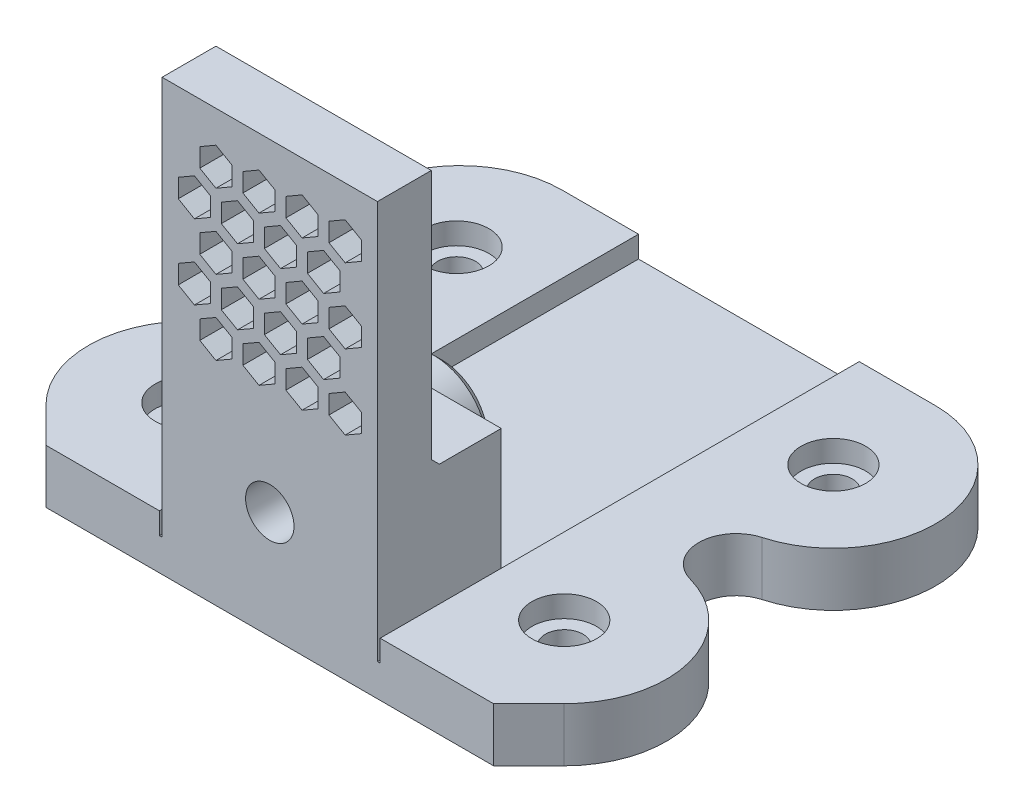
from build123d import *

# Parameters (mm, degrees)
BOSS_EXTRUDE1_DEPTH    = 20
SKETCH2_R              = 5
SKETCH2_R_2            = 2.25
BOSS_EXTRUDE2_DEPTH    = 4.5
CHAMFER1_SIZE          = 0.75
CUT_EXTRUDE1_START     = -11.5
CUT_EXTRUDE1_OUTLINE_R = 2.25
CUT_EXTRUDE1_DEPTH     = 11.5
SKETCH3_R              = 1.75
BOSS_EXTRUDE3_DEPTH    = 3
BOSS_EXTRUDE4_START    = 2
SKETCH4_R              = 3
BOSS_EXTRUDE4_DEPTH    = 2
CUT_EXTRUDE2_REACH     = 69.217


# Read off the part's stored shape, not the designer's step: Cut-Extrude1
with BuildPart() as part:
    # Sketch1 → Boss-Extrude1 (new body)
    with BuildSketch(Plane(origin=(0, 0, 0), x_dir=(0, 0, -1), z_dir=(1, 0, 0))):
        Polygon((0, 0), (0, 40), (5, 40), (5, 16.75), (5.75, 16), (11.5, 16), (11.5, 3), (44.5, 3), (44.5, 0), align=None)
    extrude(amount=-BOSS_EXTRUDE1_DEPTH)

    # Sketch2 → Boss-Extrude2 (add)
    with BuildSketch(Plane(origin=(0, 0, -11.5), x_dir=(-1, 0, 0), z_dir=(0, 0, -1))):
        with Locations(Location((10, 10, 0), (0, 0, 90))):
            Circle(SKETCH2_R)
        with Locations(Location((10, 10, 0), (0, 0, 90))):
            Circle(SKETCH2_R_2, mode=Mode.SUBTRACT)
    extrude(amount=BOSS_EXTRUDE2_DEPTH)

    # Chamfer1
    chamfer1_edges = [part.edges().sort_by_distance(p)[0] for p in [
        (-10, 5, -16),
    ]]
    chamfer(chamfer1_edges, length=CHAMFER1_SIZE)

    # Cut-Extrude1 outline → Cut-Extrude1 (cut)
    with BuildSketch(Plane(origin=(0, 0, -11.5), x_dir=(-1, 0, 0), z_dir=(0, 0, -1)).offset(CUT_EXTRUDE1_START)):
        with Locations((10, 10)):
            Circle(CUT_EXTRUDE1_OUTLINE_R)
    extrude(amount=CUT_EXTRUDE1_DEPTH, mode=Mode.SUBTRACT)

    # Sketch3 → Boss-Extrude3 (add)
    with BuildSketch(Plane(origin=(0, 3, 0), x_dir=(1, 0, 0), z_dir=(0, 1, 0))):
        with BuildLine():
            Line((0, 44.5), (7.35, 44.5))
            ThreePointArc((7.35, 44.5), (16.762886596, 36.283575445), (9.893610548, 25.846855984))
            ThreePointArc((9.893610548, 25.846855984), (7.35, 22.5), (9.893610548, 19.153144016))
            ThreePointArc((9.893610548, 19.153144016), (16.537576325, 12.416286669), (14.067514421, 3.282485579))
            Line((14.067514421, 3.282485579), (10.785028843, 0))
            Line((10.785028843, 0), (0, 0))
            Line((0, 0), (0, 11.5))
            Line((0, 11.5), (-20, 11.5))
            Line((-20, 11.5), (-20, 0))
            Line((-20, 0), (-30.785028843, 0))
            Line((-30.785028843, 0), (-34.067514421, 3.282485579))
            ThreePointArc((-34.067514421, 3.282485579), (-36.537576325, 12.416286669), (-29.893610548, 19.153144016))
            ThreePointArc((-29.893610548, 19.153144016), (-27.35, 22.5), (-29.893610548, 25.846855984))
            ThreePointArc((-29.893610548, 25.846855984), (-36.762886596, 36.283575445), (-27.35, 44.5))
            Line((-27.35, 44.5), (-20, 44.5))
            Line((-20, 44.5), (0, 44.5))
        make_face()
        with Locations(Location((7.35, 10, 0), (0, 0, 270))):
            Circle(SKETCH3_R, mode=Mode.SUBTRACT)
        with Locations(Location((7.35, 35, 0), (0, 0, 270))):
            Circle(SKETCH3_R, mode=Mode.SUBTRACT)
        with Locations(Location((-27.65, 10, 0), (0, 0, 270))):
            Circle(SKETCH3_R, mode=Mode.SUBTRACT)
        with Locations(Location((-27.65, 35, 0), (0, 0, 270))):
            Circle(SKETCH3_R, mode=Mode.SUBTRACT)
    extrude(amount=-BOSS_EXTRUDE3_DEPTH)

    # Sketch4 → Boss-Extrude4 (add)
    # profile 1 of 2: a face of its own
    with BuildSketch(Plane(origin=(0, 3, 0), x_dir=(1, 0, 0), z_dir=(0, 1, 0)).offset(BOSS_EXTRUDE4_START)):
        with BuildLine():
            Line((-30.785028843, 0), (-20.25, 0))
            Line((-20.25, 0), (-20.25, 44.5))
            Line((-20.25, 44.5), (-27.35, 44.5))
            ThreePointArc((-27.35, 44.5), (-36.762886596, 36.283575445), (-29.893610548, 25.846855984))
            ThreePointArc((-29.893610548, 25.846855984), (-27.35, 22.5), (-29.893610548, 19.153144016))
            ThreePointArc((-29.893610548, 19.153144016), (-36.537576325, 12.416286669), (-34.067514421, 3.282485579))
            Line((-34.067514421, 3.282485579), (-30.785028843, 0))
        make_face()
        with Locations(Location((-27.65, 10, 0), (0, 0, 270))):
            Circle(SKETCH4_R, mode=Mode.SUBTRACT)
        with Locations(Location((-27.65, 35, 0), (0, 0, 270))):
            Circle(SKETCH4_R, mode=Mode.SUBTRACT)
    # profile 2 of 2: a face of its own
    with BuildSketch(Plane(origin=(0, 3, 0), x_dir=(1, 0, 0), z_dir=(0, 1, 0)).offset(BOSS_EXTRUDE4_START)):
        with BuildLine():
            Line((10.785028843, 0), (14.067514421, 3.282485579))
            ThreePointArc((14.067514421, 3.282485579), (16.537576325, 12.416286669), (9.893610548, 19.153144016))
            ThreePointArc((9.893610548, 19.153144016), (7.35, 22.5), (9.893610548, 25.846855984))
            ThreePointArc((9.893610548, 25.846855984), (16.762886596, 36.283575445), (7.35, 44.5))
            Line((7.35, 44.5), (0.25, 44.5))
            Line((0.25, 44.5), (0.25, 0))
            Line((0.25, 0), (10.785028843, 0))
        make_face()
        with Locations(Location((7.35, 35, 0), (0, 0, 270))):
            Circle(SKETCH4_R, mode=Mode.SUBTRACT)
        with Locations(Location((7.35, 10, 0), (0, 0, 270))):
            Circle(SKETCH4_R, mode=Mode.SUBTRACT)
    extrude(amount=-BOSS_EXTRUDE4_DEPTH)

    # Sketch5 → Cut-Extrude2 (cut, up to next)
    with BuildSketch(Plane(origin=(0, 0, -5), x_dir=(-1, 0, 0), z_dir=(0, 0, -1)), mode=Mode.PRIVATE) as cut_extrude2_sk1:
        Polygon((3, 19.714745962), (4.5, 20.580771366), (4.5, 22.312822174), (3, 23.178847577), (1.5, 22.312822174), (1.5, 20.580771366), align=None)
    cut_extrude2_tool1 = extrude(cut_extrude2_sk1.sketch, amount=-CUT_EXTRUDE2_REACH, mode=Mode.PRIVATE) & part.part
    # Sketch5 → Cut-Extrude2 (cut, up to next)
    with BuildSketch(Plane(origin=(0, 0, -5), x_dir=(-1, 0, 0), z_dir=(0, 0, -1)), mode=Mode.PRIVATE) as cut_extrude2_sk2:
        Polygon((7, 19.714745962), (8.5, 20.580771366), (8.5, 22.312822174), (7, 23.178847577), (5.5, 22.312822174), (5.5, 20.580771366), align=None)
    cut_extrude2_tool2 = extrude(cut_extrude2_sk2.sketch, amount=-CUT_EXTRUDE2_REACH, mode=Mode.PRIVATE) & part.part
    # Sketch5 → Cut-Extrude2 (cut, up to next)
    with BuildSketch(Plane(origin=(0, 0, -5), x_dir=(-1, 0, 0), z_dir=(0, 0, -1)), mode=Mode.PRIVATE) as cut_extrude2_sk3:
        Polygon((11, 19.714745962), (12.5, 20.580771366), (12.5, 22.312822174), (11, 23.178847577), (9.5, 22.312822174), (9.5, 20.580771366), align=None)
    cut_extrude2_tool3 = extrude(cut_extrude2_sk3.sketch, amount=-CUT_EXTRUDE2_REACH, mode=Mode.PRIVATE) & part.part
    # Sketch5 → Cut-Extrude2 (cut, up to next)
    with BuildSketch(Plane(origin=(0, 0, -5), x_dir=(-1, 0, 0), z_dir=(0, 0, -1)), mode=Mode.PRIVATE) as cut_extrude2_sk4:
        Polygon((15, 19.714745962), (16.5, 20.580771366), (16.5, 22.312822174), (15, 23.178847577), (13.5, 22.312822174), (13.5, 20.580771366), align=None)
    cut_extrude2_tool4 = extrude(cut_extrude2_sk4.sketch, amount=-CUT_EXTRUDE2_REACH, mode=Mode.PRIVATE) & part.part
    # Sketch5 → Cut-Extrude2 (cut, up to next)
    with BuildSketch(Plane(origin=(0, 0, -5), x_dir=(-1, 0, 0), z_dir=(0, 0, -1)), mode=Mode.PRIVATE) as cut_extrude2_sk5:
        Polygon((5, 23.178847577), (6.5, 24.044872981), (6.5, 25.776923789), (5, 26.642949192), (3.5, 25.776923789), (3.5, 24.044872981), align=None)
    cut_extrude2_tool5 = extrude(cut_extrude2_sk5.sketch, amount=-CUT_EXTRUDE2_REACH, mode=Mode.PRIVATE) & part.part
    # Sketch5 → Cut-Extrude2 (cut, up to next)
    with BuildSketch(Plane(origin=(0, 0, -5), x_dir=(-1, 0, 0), z_dir=(0, 0, -1)), mode=Mode.PRIVATE) as cut_extrude2_sk6:
        Polygon((9, 23.178847577), (10.5, 24.044872981), (10.5, 25.776923789), (9, 26.642949192), (7.5, 25.776923789), (7.5, 24.044872981), align=None)
    cut_extrude2_tool6 = extrude(cut_extrude2_sk6.sketch, amount=-CUT_EXTRUDE2_REACH, mode=Mode.PRIVATE) & part.part
    # Sketch5 → Cut-Extrude2 (cut, up to next)
    with BuildSketch(Plane(origin=(0, 0, -5), x_dir=(-1, 0, 0), z_dir=(0, 0, -1)), mode=Mode.PRIVATE) as cut_extrude2_sk7:
        Polygon((13, 23.178847577), (14.5, 24.044872981), (14.5, 25.776923789), (13, 26.642949192), (11.5, 25.776923789), (11.5, 24.044872981), align=None)
    cut_extrude2_tool7 = extrude(cut_extrude2_sk7.sketch, amount=-CUT_EXTRUDE2_REACH, mode=Mode.PRIVATE) & part.part
    # Sketch5 → Cut-Extrude2 (cut, up to next)
    with BuildSketch(Plane(origin=(0, 0, -5), x_dir=(-1, 0, 0), z_dir=(0, 0, -1)), mode=Mode.PRIVATE) as cut_extrude2_sk8:
        Polygon((17, 23.178847577), (18.5, 24.044872981), (18.5, 25.776923789), (17, 26.642949192), (15.5, 25.776923789), (15.5, 24.044872981), align=None)
    cut_extrude2_tool8 = extrude(cut_extrude2_sk8.sketch, amount=-CUT_EXTRUDE2_REACH, mode=Mode.PRIVATE) & part.part
    # Sketch5 → Cut-Extrude2 (cut, up to next)
    with BuildSketch(Plane(origin=(0, 0, -5), x_dir=(-1, 0, 0), z_dir=(0, 0, -1)), mode=Mode.PRIVATE) as cut_extrude2_sk9:
        Polygon((3, 26.642949192), (4.5, 27.508974596), (4.5, 29.241025404), (3, 30.107050808), (1.5, 29.241025404), (1.5, 27.508974596), align=None)
    cut_extrude2_tool9 = extrude(cut_extrude2_sk9.sketch, amount=-CUT_EXTRUDE2_REACH, mode=Mode.PRIVATE) & part.part
    # Sketch5 → Cut-Extrude2 (cut, up to next)
    with BuildSketch(Plane(origin=(0, 0, -5), x_dir=(-1, 0, 0), z_dir=(0, 0, -1)), mode=Mode.PRIVATE) as cut_extrude2_sk10:
        Polygon((7, 26.642949192), (8.5, 27.508974596), (8.5, 29.241025404), (7, 30.107050808), (5.5, 29.241025404), (5.5, 27.508974596), align=None)
    cut_extrude2_tool10 = extrude(cut_extrude2_sk10.sketch, amount=-CUT_EXTRUDE2_REACH, mode=Mode.PRIVATE) & part.part
    # Sketch5 → Cut-Extrude2 (cut, up to next)
    with BuildSketch(Plane(origin=(0, 0, -5), x_dir=(-1, 0, 0), z_dir=(0, 0, -1)), mode=Mode.PRIVATE) as cut_extrude2_sk11:
        Polygon((11, 26.642949192), (12.5, 27.508974596), (12.5, 29.241025404), (11, 30.107050808), (9.5, 29.241025404), (9.5, 27.508974596), align=None)
    cut_extrude2_tool11 = extrude(cut_extrude2_sk11.sketch, amount=-CUT_EXTRUDE2_REACH, mode=Mode.PRIVATE) & part.part
    # Sketch5 → Cut-Extrude2 (cut, up to next)
    with BuildSketch(Plane(origin=(0, 0, -5), x_dir=(-1, 0, 0), z_dir=(0, 0, -1)), mode=Mode.PRIVATE) as cut_extrude2_sk12:
        Polygon((15, 26.642949192), (16.5, 27.508974596), (16.5, 29.241025404), (15, 30.107050808), (13.5, 29.241025404), (13.5, 27.508974596), align=None)
    cut_extrude2_tool12 = extrude(cut_extrude2_sk12.sketch, amount=-CUT_EXTRUDE2_REACH, mode=Mode.PRIVATE) & part.part
    # Sketch5 → Cut-Extrude2 (cut, up to next)
    with BuildSketch(Plane(origin=(0, 0, -5), x_dir=(-1, 0, 0), z_dir=(0, 0, -1)), mode=Mode.PRIVATE) as cut_extrude2_sk13:
        Polygon((5, 30.107050808), (6.5, 30.973076211), (6.5, 32.705127019), (5, 33.571152423), (3.5, 32.705127019), (3.5, 30.973076211), align=None)
    cut_extrude2_tool13 = extrude(cut_extrude2_sk13.sketch, amount=-CUT_EXTRUDE2_REACH, mode=Mode.PRIVATE) & part.part
    # Sketch5 → Cut-Extrude2 (cut, up to next)
    with BuildSketch(Plane(origin=(0, 0, -5), x_dir=(-1, 0, 0), z_dir=(0, 0, -1)), mode=Mode.PRIVATE) as cut_extrude2_sk14:
        Polygon((9, 30.107050808), (10.5, 30.973076211), (10.5, 32.705127019), (9, 33.571152423), (7.5, 32.705127019), (7.5, 30.973076211), align=None)
    cut_extrude2_tool14 = extrude(cut_extrude2_sk14.sketch, amount=-CUT_EXTRUDE2_REACH, mode=Mode.PRIVATE) & part.part
    # Sketch5 → Cut-Extrude2 (cut, up to next)
    with BuildSketch(Plane(origin=(0, 0, -5), x_dir=(-1, 0, 0), z_dir=(0, 0, -1)), mode=Mode.PRIVATE) as cut_extrude2_sk15:
        Polygon((13, 30.107050808), (14.5, 30.973076211), (14.5, 32.705127019), (13, 33.571152423), (11.5, 32.705127019), (11.5, 30.973076211), align=None)
    cut_extrude2_tool15 = extrude(cut_extrude2_sk15.sketch, amount=-CUT_EXTRUDE2_REACH, mode=Mode.PRIVATE) & part.part
    # Sketch5 → Cut-Extrude2 (cut, up to next)
    with BuildSketch(Plane(origin=(0, 0, -5), x_dir=(-1, 0, 0), z_dir=(0, 0, -1)), mode=Mode.PRIVATE) as cut_extrude2_sk16:
        Polygon((17, 30.107050808), (18.5, 30.973076211), (18.5, 32.705127019), (17, 33.571152423), (15.5, 32.705127019), (15.5, 30.973076211), align=None)
    cut_extrude2_tool16 = extrude(cut_extrude2_sk16.sketch, amount=-CUT_EXTRUDE2_REACH, mode=Mode.PRIVATE) & part.part
    # Sketch5 → Cut-Extrude2 (cut, up to next)
    with BuildSketch(Plane(origin=(0, 0, -5), x_dir=(-1, 0, 0), z_dir=(0, 0, -1)), mode=Mode.PRIVATE) as cut_extrude2_sk17:
        Polygon((3, 33.571152423), (4.5, 34.437177826), (4.5, 36.169228634), (3, 37.035254038), (1.5, 36.169228634), (1.5, 34.437177826), align=None)
    cut_extrude2_tool17 = extrude(cut_extrude2_sk17.sketch, amount=-CUT_EXTRUDE2_REACH, mode=Mode.PRIVATE) & part.part
    # Sketch5 → Cut-Extrude2 (cut, up to next)
    with BuildSketch(Plane(origin=(0, 0, -5), x_dir=(-1, 0, 0), z_dir=(0, 0, -1)), mode=Mode.PRIVATE) as cut_extrude2_sk18:
        Polygon((7, 33.571152423), (8.5, 34.437177826), (8.5, 36.169228634), (7, 37.035254038), (5.5, 36.169228634), (5.5, 34.437177826), align=None)
    cut_extrude2_tool18 = extrude(cut_extrude2_sk18.sketch, amount=-CUT_EXTRUDE2_REACH, mode=Mode.PRIVATE) & part.part
    # Sketch5 → Cut-Extrude2 (cut, up to next)
    with BuildSketch(Plane(origin=(0, 0, -5), x_dir=(-1, 0, 0), z_dir=(0, 0, -1)), mode=Mode.PRIVATE) as cut_extrude2_sk19:
        Polygon((11, 33.571152423), (12.5, 34.437177826), (12.5, 36.169228634), (11, 37.035254038), (9.5, 36.169228634), (9.5, 34.437177826), align=None)
    cut_extrude2_tool19 = extrude(cut_extrude2_sk19.sketch, amount=-CUT_EXTRUDE2_REACH, mode=Mode.PRIVATE) & part.part
    # Sketch5 → Cut-Extrude2 (cut, up to next)
    with BuildSketch(Plane(origin=(0, 0, -5), x_dir=(-1, 0, 0), z_dir=(0, 0, -1)), mode=Mode.PRIVATE) as cut_extrude2_sk20:
        Polygon((15, 33.571152423), (16.5, 34.437177826), (16.5, 36.169228634), (15, 37.035254038), (13.5, 36.169228634), (13.5, 34.437177826), align=None)
    cut_extrude2_tool20 = extrude(cut_extrude2_sk20.sketch, amount=-CUT_EXTRUDE2_REACH, mode=Mode.PRIVATE) & part.part
    add(cut_extrude2_tool1.solids().sort_by_distance((-3, 21.446797, -5))[0], mode=Mode.SUBTRACT)
    add(cut_extrude2_tool2.solids().sort_by_distance((-7, 21.446797, -5))[0], mode=Mode.SUBTRACT)
    add(cut_extrude2_tool3.solids().sort_by_distance((-11, 21.446797, -5))[0], mode=Mode.SUBTRACT)
    add(cut_extrude2_tool4.solids().sort_by_distance((-15, 21.446797, -5))[0], mode=Mode.SUBTRACT)
    add(cut_extrude2_tool5.solids().sort_by_distance((-5, 24.910898, -5))[0], mode=Mode.SUBTRACT)
    add(cut_extrude2_tool6.solids().sort_by_distance((-9, 24.910898, -5))[0], mode=Mode.SUBTRACT)
    add(cut_extrude2_tool7.solids().sort_by_distance((-13, 24.910898, -5))[0], mode=Mode.SUBTRACT)
    add(cut_extrude2_tool8.solids().sort_by_distance((-17, 24.910898, -5))[0], mode=Mode.SUBTRACT)
    add(cut_extrude2_tool9.solids().sort_by_distance((-3, 28.375, -5))[0], mode=Mode.SUBTRACT)
    add(cut_extrude2_tool10.solids().sort_by_distance((-7, 28.375, -5))[0], mode=Mode.SUBTRACT)
    add(cut_extrude2_tool11.solids().sort_by_distance((-11, 28.375, -5))[0], mode=Mode.SUBTRACT)
    add(cut_extrude2_tool12.solids().sort_by_distance((-15, 28.375, -5))[0], mode=Mode.SUBTRACT)
    add(cut_extrude2_tool13.solids().sort_by_distance((-5, 31.839102, -5))[0], mode=Mode.SUBTRACT)
    add(cut_extrude2_tool14.solids().sort_by_distance((-9, 31.839102, -5))[0], mode=Mode.SUBTRACT)
    add(cut_extrude2_tool15.solids().sort_by_distance((-13, 31.839102, -5))[0], mode=Mode.SUBTRACT)
    add(cut_extrude2_tool16.solids().sort_by_distance((-17, 31.839102, -5))[0], mode=Mode.SUBTRACT)
    add(cut_extrude2_tool17.solids().sort_by_distance((-3, 35.303203, -5))[0], mode=Mode.SUBTRACT)
    add(cut_extrude2_tool18.solids().sort_by_distance((-7, 35.303203, -5))[0], mode=Mode.SUBTRACT)
    add(cut_extrude2_tool19.solids().sort_by_distance((-11, 35.303203, -5))[0], mode=Mode.SUBTRACT)
    add(cut_extrude2_tool20.solids().sort_by_distance((-15, 35.303203, -5))[0], mode=Mode.SUBTRACT)


solid = part.part
